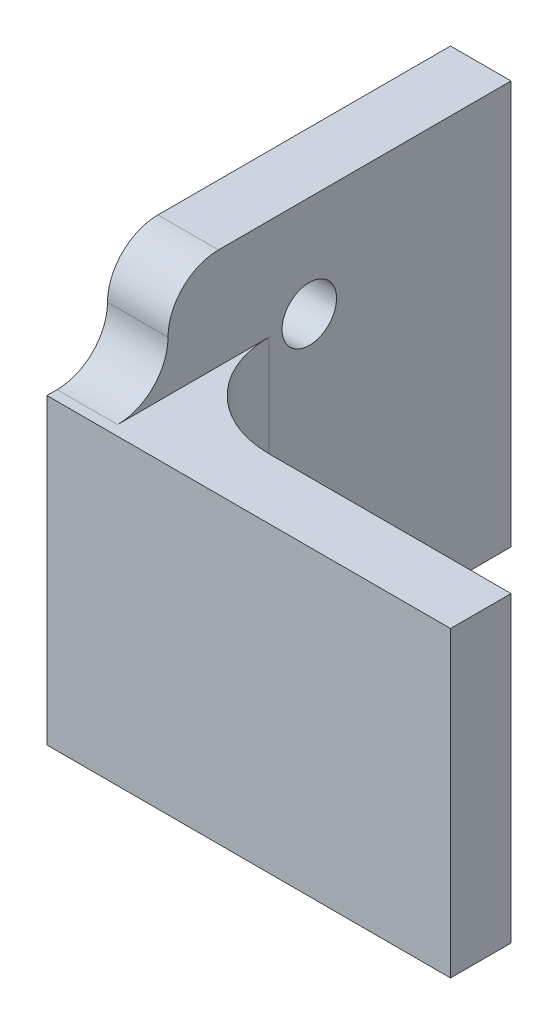
from build123d import *

# Parameters (mm, degrees)
BOSS_EXTRUDE1_DEPTH            = 20
F_2_7_2_7_DIAMETER_HOLE1_D     = 2.7
F_2_7_2_7_DIAMETER_HOLE1_DEPTH = 15
F_2_7_2_7_DIAMETER_HOLE1_TIP   = 0.811161836
SKETCH4_W                      = 20
SKETCH4_H                      = 3
CUT_EXTRUDE1_DEPTH             = 5
FILLET2_R                      = 2.5
FILLET3_R                      = 5


with BuildPart() as part:
    # Sketch1 → Boss-Extrude1 (new body)
    with BuildSketch(Plane(origin=(0, 0, 0), x_dir=(1, 0, 0), z_dir=(0, 1, 0))):
        Polygon((0, 0), (0, 17), (-3, 17), (-3, -3), (17, -3), (17, 0), align=None)
    extrude(amount=BOSS_EXTRUDE1_DEPTH)

    # Ø2.7 (2.7) Diameter Hole1
    with Locations(Plane(origin=(0, 0, 0), x_dir=(0, 0, -1), z_dir=(1, 0, 0))):
        with Locations((7, 5), (7, 15)):
            Hole(F_2_7_2_7_DIAMETER_HOLE1_D / 2, depth=F_2_7_2_7_DIAMETER_HOLE1_DEPTH)
            with Locations((0, 0, -(F_2_7_2_7_DIAMETER_HOLE1_DEPTH + F_2_7_2_7_DIAMETER_HOLE1_TIP / 2))):  # 118° drill point
                Cone(0, F_2_7_2_7_DIAMETER_HOLE1_D / 2, F_2_7_2_7_DIAMETER_HOLE1_TIP, mode=Mode.SUBTRACT)

    # Sketch4 → Cut-Extrude1 (cut)
    with BuildSketch(Plane(origin=(0, 20, 0), x_dir=(1, 0, 0), z_dir=(0, 1, 0))):
        with Locations((7, -1.5)):
            Rectangle(SKETCH4_W, SKETCH4_H)
    extrude(amount=-CUT_EXTRUDE1_DEPTH, mode=Mode.SUBTRACT)

    # Fillet2
    fillet2_edges = [part.edges().sort_by_distance(p)[0] for p in [
        (-1.5, 15, 0),
    ]]
    fillet(fillet2_edges, radius=FILLET2_R)
    fillet2_2_edges = [part.edges().sort_by_distance(p)[0] for p in [
        (-1.5, 20, 0),
    ]]
    fillet(fillet2_2_edges, radius=FILLET2_R - 0.0001)  # a hair under: the kernel refuses the full size

    # Fillet3
    fillet3_edges = [part.edges().sort_by_distance(p)[0] for p in [
        (0, 7.5, 0),
    ]]
    fillet(fillet3_edges, radius=FILLET3_R)


solid = part.part
